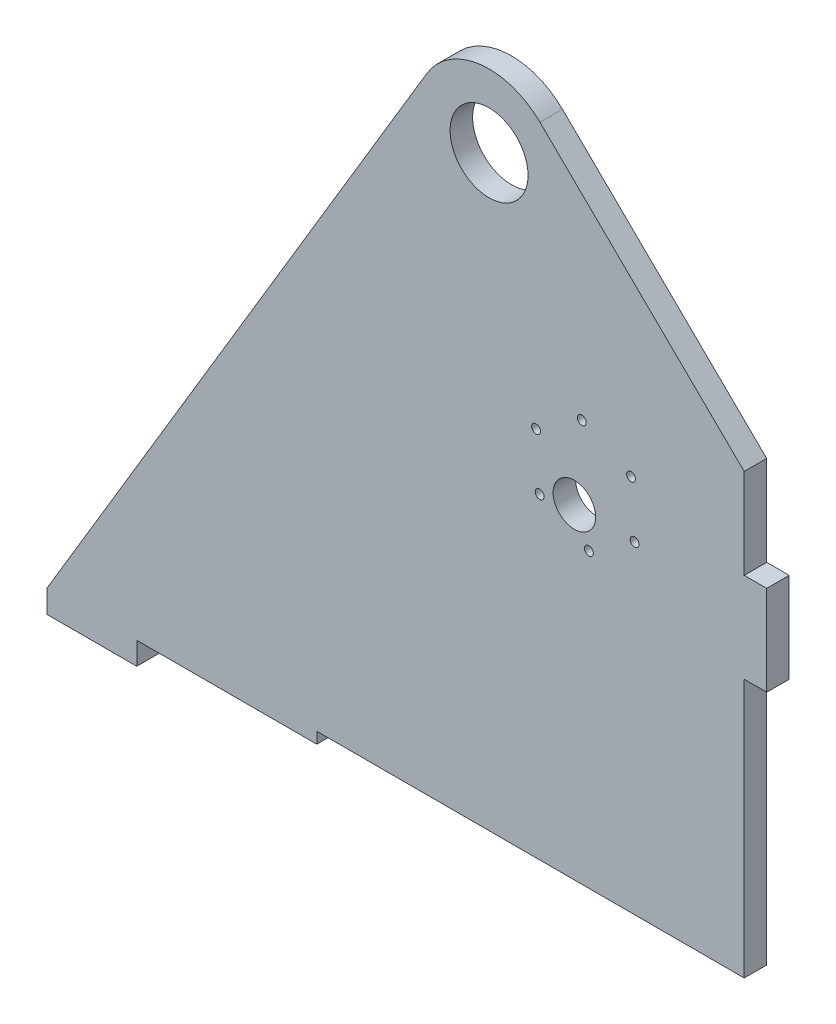
from build123d import *

# Parameters (mm, degrees)
SKETCH2_R               = 11
BOSS_EXTRUDE1_DEPTH     = 6.35
CUT_EXTRUDE2_DEPTH      = 283.224719638
CUT_EXTRUDE2_DEPTH_BACK = 283.224719638
SKETCH5_R               = 6
SKETCH5_R_2             = 1.25


with BuildPart() as part:
    # Sketch2 → Boss-Extrude1 (new body)
    with BuildSketch(Plane.XY):
        with BuildLine():
            Line((25.4, 6.35), (76.2, 6.35))
            Line((76.2, 6.35), (76.2, 9.525))
            Line((76.2, 9.525), (83.986447759, 9.525))
            Line((83.986447759, 9.525), (196.85, 9.525))
            Line((196.85, 9.525), (196.85, 82.55))
            Line((196.85, 82.55), (203.2, 82.55))
            Line((203.2, 82.55), (203.2, 107.95))
            Line((203.2, 107.95), (196.85, 107.95))
            Line((196.85, 107.95), (196.85, 133.35))
            Line((196.85, 133.35), (139.204596213, 189.884425208))
            ThreePointArc((139.204596213, 189.884425208), (122.208232851, 195.586998388), (107.214428724, 185.75940732))
            Line((107.214428724, 185.75940732), (0, 6.35))
            Line((0, 6.35), (0, 0))
            Line((0, 0), (25.4, 0))
            Line((25.4, 0), (25.4, 6.35))
        make_face()
        with Locations((124.833126, 175.230536)):
            Circle(SKETCH2_R, mode=Mode.SUBTRACT)
    extrude(amount=BOSS_EXTRUDE1_DEPTH)

    # Sketch5 → Cut-Extrude2 (cut, two sides: drawn at the far end of the back side and taken through both)
    with BuildSketch(Plane(origin=(0, 0, 0), x_dir=(-1, 0, 0), z_dir=(0, 0, -1)).offset(-CUT_EXTRUDE2_DEPTH_BACK)):
        with Locations((-148.907192183, 101.23186166)):
            Circle(SKETCH5_R)
        with Locations((-164.900459595, 116.111139536)):
            Circle(SKETCH5_R_2)
        with Locations((-165.904369821, 100.643684533)):
            Circle(SKETCH5_R_2)
        with Locations((-153.01111597, 92.040545273)):
            Circle(SKETCH5_R_2)
        with Locations((-151.003295518, 122.975455278)):
            Circle(SKETCH5_R_2)
        with Locations((-138.110041667, 114.372316018)):
            Circle(SKETCH5_R_2)
        with Locations((-139.113951893, 98.904861015)):
            Circle(SKETCH5_R_2)
    extrude(amount=CUT_EXTRUDE2_DEPTH + CUT_EXTRUDE2_DEPTH_BACK, mode=Mode.SUBTRACT)


solid = part.part
